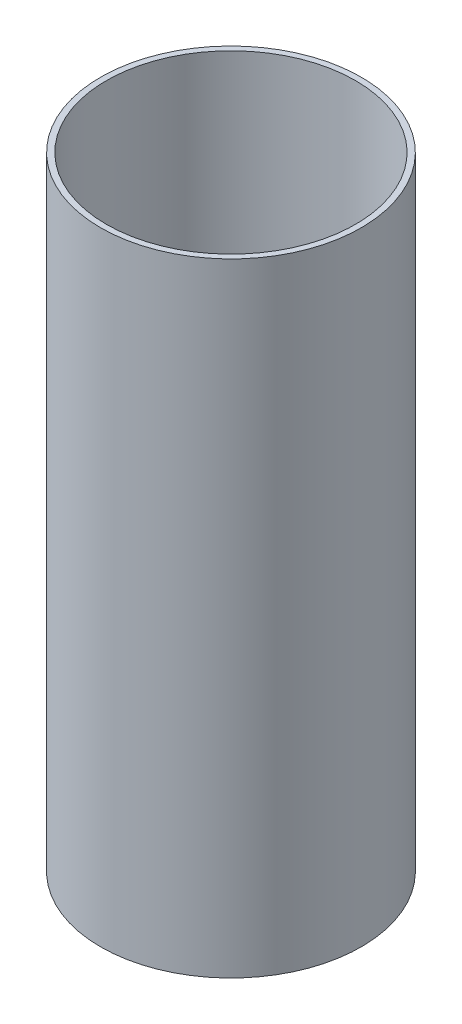
from build123d import *

# Parameters (mm, degrees)
SKETCH1_R           = 16.75
SKETCH1_R_2         = 16
BOSS_EXTRUDE1_DEPTH = 80


with BuildPart() as part:
    # Sketch1 → Boss-Extrude1 (new body)
    with BuildSketch(Plane(origin=(0, 0, 0), x_dir=(1, 0, 0), z_dir=(0, 1, 0))):
        Circle(SKETCH1_R)
        Circle(SKETCH1_R_2, mode=Mode.SUBTRACT)
    extrude(amount=BOSS_EXTRUDE1_DEPTH)


solid = part.part
